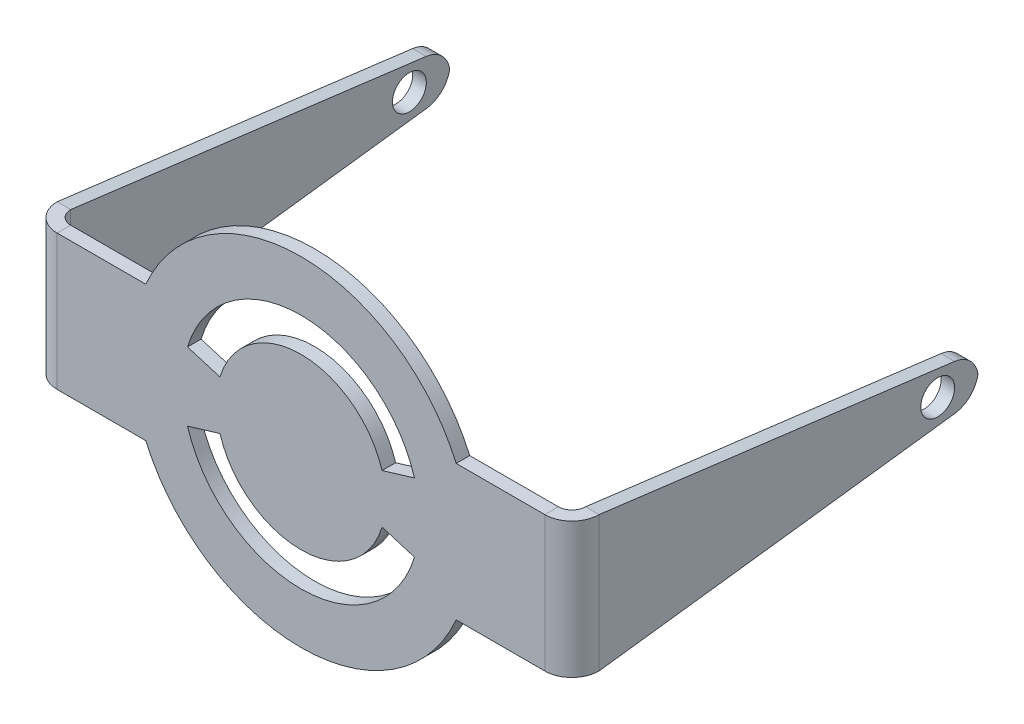
from build123d import *

# Parameters (mm, degrees)
SM_BASE_FLANGE_1_DEPTH = 25
CUT_EXTRUDE_2_REACH    = 47.389
SKETCH_7_W             = 2
SKETCH_7_H             = 7.5
CUT_EXTRUDE_3_REACH    = 53.538
SKETCH_8_R             = 1.25
FILLET_1_R             = 2
CUT_EXTRUDE_4_DEPTH    = 10


# Sheet-metal steps are written as plain solids
with BuildPart() as part:
    # Sketch 1 → 基体-法兰1 (new body)
    with BuildSketch(Plane(origin=(0, 0, 0), x_dir=(1, 0, 0), z_dir=(0, 1, 0))):
        with BuildLine():
            Line((-23.132778959, 20.763530703), (-23.132778959, -7.236469297))
            ThreePointArc((-23.132778959, -7.236469297), (-22.546992522, -8.650682859), (-21.132778959, -9.236469297))
            Line((-21.132778959, -9.236469297), (14.867221041, -9.236469297))
            ThreePointArc((14.867221041, -9.236469297), (16.281434603, -8.650682859), (16.867221041, -7.236469297))
            Line((16.867221041, -7.236469297), (16.867221041, 20.763530703))
            Line((16.867221041, 20.763530703), (15.867221041, 20.763530703))
            Line((15.867221041, 20.763530703), (15.867221041, -7.236469297))
            ThreePointArc((15.867221041, -7.236469297), (15.574327822, -7.943576078), (14.867221041, -8.236469297))
            Line((14.867221041, -8.236469297), (-21.132778959, -8.236469297))
            ThreePointArc((-21.132778959, -8.236469297), (-21.839885741, -7.943576078), (-22.132778959, -7.236469297))
            Line((-22.132778959, -7.236469297), (-22.132778959, 20.763530703))
            Line((-22.132778959, 20.763530703), (-23.132778959, 20.763530703))
        make_face()
    extrude(amount=SM_BASE_FLANGE_1_DEPTH)

    # 切除-拉伸2: up to this face of the body (flat: up to its plane)
    cut_extrude_2_end = Plane(part.part.faces().sort_by_distance((-22.632778959, 12.5, -20.763530703))[0])
    # 草图7 → 切除-拉伸2 (cut, up to the picked face)
    with BuildSketch(Plane.XY.offset(9.236469297), mode=Mode.PRIVATE) as cut_extrude_2_sk1:
        with BuildLine():
            Line((-21.132778959, 25), (-21.132778959, 17.5))
            Line((-21.132778959, 17.5), (-14.589218197, 17.5))
            ThreePointArc((-14.589218197, 17.5), (-9.979310906, 22.958250346), (-3.132778905, 25))
            Line((-3.132778905, 25), (-21.132778959, 25))
        make_face()
    cut_extrude_2_tool1 = split(extrude(cut_extrude_2_sk1.sketch, amount=-CUT_EXTRUDE_2_REACH, mode=Mode.PRIVATE), bisect_by=cut_extrude_2_end, keep=Keep.BOTH, mode=Mode.PRIVATE)
    # 草图7 → 切除-拉伸2 (cut, up to the picked face)
    with BuildSketch(Plane.XY.offset(9.236469297), mode=Mode.PRIVATE) as cut_extrude_2_sk2:
        with Locations((-22.132778959, 21.25)):
            Rectangle(SKETCH_7_W, SKETCH_7_H)
    cut_extrude_2_tool2 = split(extrude(cut_extrude_2_sk2.sketch, amount=-CUT_EXTRUDE_2_REACH, mode=Mode.PRIVATE), bisect_by=cut_extrude_2_end, keep=Keep.BOTH, mode=Mode.PRIVATE)
    # 草图7 → 切除-拉伸2 (cut, up to the picked face)
    with BuildSketch(Plane.XY.offset(9.236469297), mode=Mode.PRIVATE) as cut_extrude_2_sk3:
        with BuildLine():
            Line((14.867221041, 25), (-3.132778905, 25))
            ThreePointArc((-3.132778905, 25), (3.713753032, 22.958250317), (8.323660278, 17.5))
            Line((8.323660278, 17.5), (14.867221041, 17.5))
            Line((14.867221041, 17.5), (14.867221041, 25))
        make_face()
    cut_extrude_2_tool3 = split(extrude(cut_extrude_2_sk3.sketch, amount=-CUT_EXTRUDE_2_REACH, mode=Mode.PRIVATE), bisect_by=cut_extrude_2_end, keep=Keep.BOTH, mode=Mode.PRIVATE)
    # 草图7 → 切除-拉伸2 (cut, up to the picked face)
    with BuildSketch(Plane.XY.offset(9.236469297), mode=Mode.PRIVATE) as cut_extrude_2_sk4:
        with Locations((15.867221041, 21.25)):
            Rectangle(SKETCH_7_W, SKETCH_7_H)
    cut_extrude_2_tool4 = split(extrude(cut_extrude_2_sk4.sketch, amount=-CUT_EXTRUDE_2_REACH, mode=Mode.PRIVATE), bisect_by=cut_extrude_2_end, keep=Keep.BOTH, mode=Mode.PRIVATE)
    # 草图7 → 切除-拉伸2 (cut, up to the picked face)
    with BuildSketch(Plane.XY.offset(9.236469297), mode=Mode.PRIVATE) as cut_extrude_2_sk5:
        with Locations((15.867221041, 3.75)):
            Rectangle(SKETCH_7_W, SKETCH_7_H)
    cut_extrude_2_tool5 = split(extrude(cut_extrude_2_sk5.sketch, amount=-CUT_EXTRUDE_2_REACH, mode=Mode.PRIVATE), bisect_by=cut_extrude_2_end, keep=Keep.BOTH, mode=Mode.PRIVATE)
    # 草图7 → 切除-拉伸2 (cut, up to the picked face)
    with BuildSketch(Plane.XY.offset(9.236469297), mode=Mode.PRIVATE) as cut_extrude_2_sk6:
        with BuildLine():
            ThreePointArc((8.323660278, 7.5), (3.713752992, 2.041749657), (-3.132779, 0))
            Line((-3.132779, 0), (14.867221041, 0))
            Line((14.867221041, 0), (14.867221041, 7.5))
            Line((14.867221041, 7.5), (8.323660278, 7.5))
        make_face()
    cut_extrude_2_tool6 = split(extrude(cut_extrude_2_sk6.sketch, amount=-CUT_EXTRUDE_2_REACH, mode=Mode.PRIVATE), bisect_by=cut_extrude_2_end, keep=Keep.BOTH, mode=Mode.PRIVATE)
    # 草图7 → 切除-拉伸2 (cut, up to the picked face)
    with BuildSketch(Plane.XY.offset(9.236469297), mode=Mode.PRIVATE) as cut_extrude_2_sk7:
        with BuildLine():
            Line((-14.589218197, 7.5), (-21.132778959, 7.5))
            Line((-21.132778959, 7.5), (-21.132778959, 0))
            Line((-21.132778959, 0), (-3.132779, 0))
            ThreePointArc((-3.132779, 0), (-9.979310945, 2.041749679), (-14.589218197, 7.5))
        make_face()
    cut_extrude_2_tool7 = split(extrude(cut_extrude_2_sk7.sketch, amount=-CUT_EXTRUDE_2_REACH, mode=Mode.PRIVATE), bisect_by=cut_extrude_2_end, keep=Keep.BOTH, mode=Mode.PRIVATE)
    # 草图7 → 切除-拉伸2 (cut, up to the picked face)
    with BuildSketch(Plane.XY.offset(9.236469297), mode=Mode.PRIVATE) as cut_extrude_2_sk8:
        with Locations((-22.132778959, 3.75)):
            Rectangle(SKETCH_7_W, SKETCH_7_H)
    cut_extrude_2_tool8 = split(extrude(cut_extrude_2_sk8.sketch, amount=-CUT_EXTRUDE_2_REACH, mode=Mode.PRIVATE), bisect_by=cut_extrude_2_end, keep=Keep.BOTH, mode=Mode.PRIVATE)
    add(cut_extrude_2_tool1.solids().sort_by(Axis((-15.911203, 21.806262, 9.236469), (0, 0, -1)))[0], mode=Mode.SUBTRACT)
    add(cut_extrude_2_tool2.solids().sort_by(Axis((-22.132779, 21.25, 9.236469), (0, 0, -1)))[0], mode=Mode.SUBTRACT)
    add(cut_extrude_2_tool3.solids().sort_by(Axis((9.645646, 21.806262, 9.236469), (0, 0, -1)))[0], mode=Mode.SUBTRACT)
    add(cut_extrude_2_tool4.solids().sort_by(Axis((15.867221, 21.25, 9.236469), (0, 0, -1)))[0], mode=Mode.SUBTRACT)
    add(cut_extrude_2_tool5.solids().sort_by(Axis((15.867221, 3.75, 9.236469), (0, 0, -1)))[0], mode=Mode.SUBTRACT)
    add(cut_extrude_2_tool6.solids().sort_by(Axis((9.645646, 3.193738, 9.236469), (0, 0, -1)))[0], mode=Mode.SUBTRACT)
    add(cut_extrude_2_tool7.solids().sort_by(Axis((-15.911203, 3.193738, 9.236469), (0, 0, -1)))[0], mode=Mode.SUBTRACT)
    add(cut_extrude_2_tool8.solids().sort_by(Axis((-22.132779, 3.75, 9.236469), (0, 0, -1)))[0], mode=Mode.SUBTRACT)

    # 切除-拉伸3: up to this face of the body (flat: up to its plane)
    cut_extrude_3_end = Plane(part.part.faces().sort_by_distance((-23.132778959, 12.5, -6.763530703))[0])
    # 草图8 → 切除-拉伸3 (cut, up to the picked face)
    with BuildSketch(Plane(origin=(16.867221041, 0, 0), x_dir=(0, 0, -1), z_dir=(1, 0, 0)), mode=Mode.PRIVATE) as cut_extrude_3_sk1:
        Polygon((20.763530703, 17.5), (-7.236469297, 17.5), (20.763530703, 13.95), align=None)
    cut_extrude_3_tool1 = split(extrude(cut_extrude_3_sk1.sketch, amount=-CUT_EXTRUDE_3_REACH, mode=Mode.PRIVATE), bisect_by=cut_extrude_3_end, keep=Keep.BOTH, mode=Mode.PRIVATE)
    # 草图8 → 切除-拉伸3 (cut, up to the picked face)
    with BuildSketch(Plane(origin=(16.867221041, 0, 0), x_dir=(0, 0, -1), z_dir=(1, 0, 0)), mode=Mode.PRIVATE) as cut_extrude_3_sk2:
        Polygon((20.763530703, 11.051298474), (-7.236469297, 7.5), (20.763530703, 7.5), align=None)
    cut_extrude_3_tool2 = split(extrude(cut_extrude_3_sk2.sketch, amount=-CUT_EXTRUDE_3_REACH, mode=Mode.PRIVATE), bisect_by=cut_extrude_3_end, keep=Keep.BOTH, mode=Mode.PRIVATE)
    # 草图8 → 切除-拉伸3 (cut, up to the picked face)
    with BuildSketch(Plane(origin=(16.867221041, 0, 0), x_dir=(0, 0, -1), z_dir=(1, 0, 0)), mode=Mode.PRIVATE) as cut_extrude_3_sk3:
        with Locations(Location((17.763530703, 12.5, 0), (0, 0, 180))):
            Circle(SKETCH_8_R)
    cut_extrude_3_tool3 = split(extrude(cut_extrude_3_sk3.sketch, amount=-CUT_EXTRUDE_3_REACH, mode=Mode.PRIVATE), bisect_by=cut_extrude_3_end, keep=Keep.BOTH, mode=Mode.PRIVATE)
    add(cut_extrude_3_tool1.solids().sort_by(Axis((16.867221, 16.316667, -11.430197), (-1, 0, 0)))[0], mode=Mode.SUBTRACT)
    add(cut_extrude_3_tool2.solids().sort_by(Axis((16.867221, 8.683766, -11.430197), (-1, 0, 0)))[0], mode=Mode.SUBTRACT)
    add(cut_extrude_3_tool3.solids().sort_by(Axis((16.867221, 12.5, -17.763531), (-1, 0, 0)))[0], mode=Mode.SUBTRACT)

    # 圆角1
    # the kernel refuses this fillet: 2 mm, written as the material it takes off along each edge
    with BuildSketch(Plane(origin=(-17.726883899, 11.051298474, -20.763530703), x_dir=(0, -0.12582409885038226, 0.9920525672304312), z_dir=(-1, 0, 0)), Plane(origin=(21.273116101, 11.051298474, -20.763530703), x_dir=(0, -0.12582409885038226, 0.9920525672304312), z_dir=(-1, 0, 0))) as fillet_1_piece_1:
        with BuildLine():
            CenterArc((FILLET_1_R * 0.881179012106, FILLET_1_R), FILLET_1_R, 187.228348929, 82.771651071)
            Line((-FILLET_1_R * 0.110873555124, FILLET_1_R * 0.87417590115), (0, 0))
            Line((0, 0), (FILLET_1_R * 0.881179012106, 0))
        make_face()
    extrude(amount=9.811790121, mode=Mode.SUBTRACT)
    with BuildSketch(Plane(origin=(-17.726681198, 13.95, -20.763530703), x_dir=(0, -1, 0), z_dir=(-1, 0, 0))) as fillet_1_piece_2:
        with BuildLine():
            CenterArc((FILLET_1_R * 0.881219552242, FILLET_1_R), FILLET_1_R, 187.225733942, 82.774266058)
            Line((-FILLET_1_R * 0.110838756585, FILLET_1_R * 0.874221178702), (0, 0))
            Line((0, 0), (FILLET_1_R * 0.881219552242, 0))
        make_face()
    extrude(amount=9.812195522, mode=Mode.SUBTRACT)
    with BuildSketch(Plane(origin=(21.273318802, 13.95, -20.763530703), x_dir=(0, 0.12577882129772675, 0.9920583088271347), z_dir=(-1, 0, 0))) as fillet_1_piece_3:
        with BuildLine():
            CenterArc((FILLET_1_R * 0.881219552242, -FILLET_1_R), FILLET_1_R, 90, 82.774266058)
            Line((-FILLET_1_R * 0.110838756585, -FILLET_1_R * 0.874221178702), (0, 0))
            Line((0, 0), (FILLET_1_R * 0.881219552242, 0))
        make_face()
    extrude(amount=9.812195522, mode=Mode.SUBTRACT)

    # 草图9 → 切除-拉伸4 (cut)
    with BuildSketch(Plane.XY.offset(9.236469297)):
        with BuildLine():
            ThreePointArc((2.849937878, 14.308203319), (-3.132778959, 18.75), (-9.115495797, 14.308203319))
            Line((-9.115495797, 14.308203319), (-11.508582532, 15.031484647))
            ThreePointArc((-11.508582532, 15.031484647), (-3.132778959, 21.25), (5.243024613, 15.031484647))
            Line((5.243024613, 15.031484647), (2.849937878, 14.308203319))
        make_face()
        with BuildLine():
            Line((-9.115495797, 10.691796681), (-11.508582532, 9.968515353))
            ThreePointArc((-11.508582532, 9.968515353), (-3.132778959, 3.75), (5.243024613, 9.968515353))
            Line((5.243024613, 9.968515353), (2.849937878, 10.691796681))
            ThreePointArc((2.849937878, 10.691796681), (-3.132778959, 6.25), (-9.115495797, 10.691796681))
        make_face()
    extrude(amount=-CUT_EXTRUDE_4_DEPTH, mode=Mode.SUBTRACT)


solid = part.part
